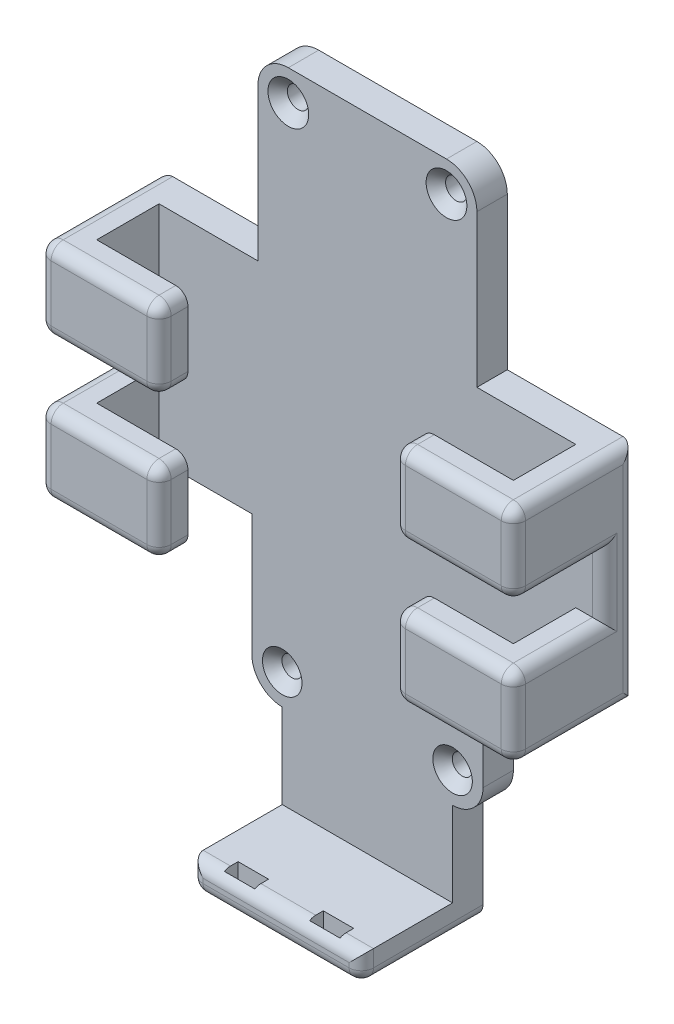
from build123d import *
from build123d.topology import SkipClean

# Parameters (mm, degrees)
SKETCH1_R           = 1.6500000000000001
SKETCH1_R_2         = 1.6499999999999986
SKETCH1_R_3         = 1.7500000000000004
BOSS_EXTRUDE1_DEPTH = 5
CHAMFER1_SIZE       = 1.6
SKETCH4_W           = 28
SKETCH4_H           = 4.75
BOSS_EXTRUDE2_DEPTH = 15
BOSS_EXTRUDE3_DEPTH = 15
CUT_EXTRUDE1_DEPTH  = 10
SKETCH9_W           = 4.749999999999998
SKETCH9_H           = 13.250000000000005
BOSS_EXTRUDE4_DEPTH = 15
SKETCH10_W          = 5.000000000000001
SKETCH10_H          = 2.2500000000000036
CUT_EXTRUDE2_DEPTH  = 15
SKETCH11_W          = 15
SKETCH11_H          = 10.000000000000002
CUT_EXTRUDE3_DEPTH  = 15
FILLET1_R           = 2
CHAMFER2_SIZE       = 1.6


with BuildPart() as part:
    # Sketch1 → Boss-Extrude1 (new body)
    with BuildSketch(Plane.XY):
        with BuildLine():
            Line((-18.000000000000004, 57.02680671662054), (-18.00000000000001, -24.473193283379477))
            ThreePointArc((-18.00000000000001, -24.473193283379477), (-16.872983346207427, -27.635470943547862), (-14.000000000000002, -29.372172768945834))
            Line((-14.000000000000002, -29.372172768945834), (-13.999999999999998, -48.122172768945845))
            Line((-13.999999999999998, -48.122172768945845), (14.000000000000004, -48.122172768945845))
            Line((14.000000000000004, -48.122172768945845), (14.000000000000004, -29.473193283379494))
            ThreePointArc((14.000000000000004, -29.473193283379494), (17.535533905932745, -28.008727189312218), (19.000000000000007, -24.47319328337948))
            Line((19.000000000000007, -24.47319328337948), (19.00000000000001, -4.47319328337948))
            Line((19.00000000000001, -4.47319328337948), (39.00000000000001, -4.4731932833794765))
            Line((39.00000000000001, -4.4731932833794765), (39, 32.026806716620534))
            Line((39, 32.026806716620534), (18.000000000000004, 32.026806716620534))
            Line((18.000000000000004, 32.026806716620534), (17.99999999999999, 52.02680671662054))
            Line((17.99999999999999, 52.02680671662054), (18.000000000000004, 57.02680671662054))
            ThreePointArc((18.000000000000004, 57.02680671662054), (16.535533905932727, 60.562340622553265), (13, 62.02680671662053))
            Line((13, 62.02680671662053), (-13, 62.02680671662053))
            ThreePointArc((-13, 62.02680671662053), (-16.535533905932738, 60.56234062255327), (-18.000000000000004, 57.02680671662054))
        make_face()
        with Locations((-14.000000000000002, -24.473193283379477)):
            Circle(SKETCH1_R, mode=Mode.SUBTRACT)
        with Locations((14.000000000000002, -24.473193283379477)):
            Circle(SKETCH1_R_2, mode=Mode.SUBTRACT)
        with Locations((-13.000000000000009, 57.02680671662053)):
            Circle(SKETCH1_R_3, mode=Mode.SUBTRACT)
        with Locations(Location((13, 57.02680671662054, 0), (0, 0, 180))):
            Circle(SKETCH1_R_3, mode=Mode.SUBTRACT)
    boss_extrude1 = extrude(amount=BOSS_EXTRUDE1_DEPTH)

    # Chamfer1
    chamfer1_edges = [part.edges().sort_by_distance(p)[0] for p in [
        (-14.750000000000009, 57.02680671662053, 0),
        (14.75, 57.02680671662054, 0),
        (-15.650000000000002, -24.473193283379477, 0),
        (12.350000000000003, -24.473193283379477, 0),
    ]]
    chamfer(chamfer1_edges, length=CHAMFER1_SIZE)

    # Sketch4 → Boss-Extrude2 (add)
    with BuildSketch(Plane.XY.offset(5)):
        with Locations((2.66e-15, -45.747172768945845)):
            Rectangle(SKETCH4_W, SKETCH4_H)
    extrude(amount=BOSS_EXTRUDE2_DEPTH)

    # Sketch7 → Boss-Extrude3 (add)
    with BuildSketch(Plane.XY.offset(5)):
        Polygon((39.00000000000001, 32.026806716620534), (39.000000000000014, -4.47319328337948), (34.250000000000014, -4.47319328337948), (34.25000000000001, 32.026806716620534), align=None)
    boss_extrude3 = extrude(amount=BOSS_EXTRUDE3_DEPTH)

    # Sketch8 → Cut-Extrude1 (cut)
    with BuildSketch(Plane.ZY.offset(-34.250000000000014)):
        Polygon((20, 8.776806716620532), (5, 8.77680671662053), (5, 18.776806716620534), (20, 18.776806716620534), align=None)
    extrude(amount=-CUT_EXTRUDE1_DEPTH, mode=Mode.SUBTRACT)

    # Sketch9 → Boss-Extrude4 (add)
    with BuildSketch(Plane.ZY.offset(-34.250000000000014)):
        Polygon((20, 32.026806716620534), (15.25, 32.026806716620534), (15.250000000000002, 18.776806716620534), (20.000000000000004, 18.776806716620534), align=None)
        with Locations((17.625, 2.1518067166205297)):
            Rectangle(SKETCH9_W, SKETCH9_H)
    boss_extrude4 = extrude(amount=BOSS_EXTRUDE4_DEPTH)

    # Mirror1: Boss-Extrude1, Boss-Extrude3, Boss-Extrude4 across plane
    with SkipClean():  # the faces are left unmerged after this step: merging them gives an invalid solid
        add(boss_extrude1.mirror(Plane(origin=(0, 0, 0), x_dir=(0, 0, 1), z_dir=(1, 9e-17, 0))))
        add(boss_extrude3.mirror(Plane(origin=(0, 0, 0), x_dir=(0, 0, 1), z_dir=(1, 9e-17, 0))))
        add(boss_extrude4.mirror(Plane(origin=(0, 0, 0), x_dir=(0, 0, 1), z_dir=(1, 9e-17, 0))))

    # Sketch10 → Cut-Extrude2 (cut)
    with SkipClean():  # the faces are left unmerged after this step: merging them gives an invalid solid
        with BuildSketch(Plane(origin=(0, -43.372172768945845, 0), x_dir=(1, 0, 0), z_dir=(0, 1, 0))):
            with Locations((-7.000000000000002, -17.875)):
                Rectangle(SKETCH10_W, SKETCH10_H)
            with Locations((7.000000000000002, -17.875)):
                Rectangle(SKETCH10_W, SKETCH10_H)
        extrude(amount=-CUT_EXTRUDE2_DEPTH, mode=Mode.SUBTRACT)

    # Sketch11 → Cut-Extrude3 (cut)
    with SkipClean():  # the faces are left unmerged after this step: merging them gives an invalid solid
        with BuildSketch(Plane(origin=(-34.250000000000014, 1.7e-16, 0), x_dir=(0, 0, -1), z_dir=(1, -1e-17, 0))):
            with Locations((-12.5, 13.776806716620541)):
                Rectangle(SKETCH11_W, SKETCH11_H)
        extrude(amount=-CUT_EXTRUDE3_DEPTH, mode=Mode.SUBTRACT)

    # Fillet1
    # the kernel refuses this fillet: 2 mm, written as the material it takes off along each edge
    with BuildSketch(Plane(origin=(37.00000000000001, 30.026806716620534, 18), x_dir=(0, 1, 0), z_dir=(0, 0, 1))) as fillet1_piece_1_section:
        Polygon((0, 0), (FILLET1_R, 0), (FILLET1_R, -FILLET1_R), (3.9e-16, -FILLET1_R), align=None)
    fillet1_piece_1 = extrude(amount=FILLET1_R, mode=Mode.PRIVATE)
    fillet1_piece_1 = fillet1_piece_1 - Plane(origin=(37.00000000000001, 30.026806716620534, 18), x_dir=(-0.7071067811865475, -0.7071067811865477, 0), z_dir=(0, 0, 1)) * Sphere(FILLET1_R, mode=Mode.PRIVATE)
    add(fillet1_piece_1, mode=Mode.SUBTRACT)
    with BuildSketch(Plane(origin=(37.00000000000001, 20.77680671662054, 18), x_dir=(9e-17, -1, 0), z_dir=(0, 0, 1))) as fillet1_piece_2_section:
        Polygon((0, 0), (FILLET1_R, 0), (FILLET1_R, FILLET1_R), (-2.1e-16, FILLET1_R), align=None)
    fillet1_piece_2 = extrude(amount=FILLET1_R, mode=Mode.PRIVATE)
    fillet1_piece_2 = fillet1_piece_2 - Plane(origin=(37.00000000000001, 20.77680671662054, 18), x_dir=(-0.7071067811865476, 0.7071067811865475, 0), z_dir=(0, 0, 1)) * Sphere(FILLET1_R, mode=Mode.PRIVATE)
    add(fillet1_piece_2, mode=Mode.SUBTRACT)
    with BuildSketch(Plane(origin=(21.250000000000014, 20.776806716620538, 18), x_dir=(-1, -9e-17, 0), z_dir=(0, 0, 1))) as fillet1_piece_3_section:
        Polygon((0, 0), (FILLET1_R, 0), (FILLET1_R, FILLET1_R), (0, FILLET1_R), align=None)
    fillet1_piece_3 = extrude(amount=FILLET1_R, mode=Mode.PRIVATE)
    fillet1_piece_3 = fillet1_piece_3 - Plane(origin=(21.250000000000014, 20.776806716620538, 18), x_dir=(0.7071067811865475, 0.7071067811865476, 0), z_dir=(0, 0, 1)) * Sphere(FILLET1_R, mode=Mode.PRIVATE)
    add(fillet1_piece_3, mode=Mode.SUBTRACT)
    with BuildSketch(Plane(origin=(21.250000000000014, 6.776806716620538, 18), x_dir=(0, 0, 1), z_dir=(-9e-17, 1, -1.2e-16))) as fillet1_piece_4_section:
        Polygon((0, 0), (FILLET1_R, 0), (FILLET1_R, -FILLET1_R), (0, -FILLET1_R), align=None)
    fillet1_piece_4 = extrude(amount=FILLET1_R, mode=Mode.PRIVATE)
    fillet1_piece_4 = fillet1_piece_4 - Plane(origin=(21.250000000000014, 6.776806716620538, 18), x_dir=(0.7071067811865475, 0, -0.7071067811865475), z_dir=(-9e-17, 1, -1.2e-16)) * Sphere(FILLET1_R, mode=Mode.PRIVATE)
    add(fillet1_piece_4, mode=Mode.SUBTRACT)
    with BuildSketch(Plane(origin=(37.000000000000014, 6.7768067166205395, 18), x_dir=(0, 0, 1), z_dir=(-9e-17, 1, -1.2e-16))) as fillet1_piece_5_section:
        Polygon((0, 0), (FILLET1_R, 0), (FILLET1_R, FILLET1_R), (0, FILLET1_R), align=None)
    fillet1_piece_5 = extrude(amount=FILLET1_R, mode=Mode.PRIVATE)
    fillet1_piece_5 = fillet1_piece_5 - Plane(origin=(37.000000000000014, 6.7768067166205395, 18), x_dir=(-0.7071067811865475, 0, -0.7071067811865475), z_dir=(-9e-17, 1, -1.2e-16)) * Sphere(FILLET1_R, mode=Mode.PRIVATE)
    add(fillet1_piece_5, mode=Mode.SUBTRACT)
    with BuildSketch(Plane(origin=(21.25000000000001, 30.02680671662054, 18), x_dir=(-1, -9e-17, 0), z_dir=(0, 0, 1))) as fillet1_piece_6_section:
        Polygon((0, 0), (FILLET1_R, 0), (FILLET1_R, -FILLET1_R), (-1.8e-16, -FILLET1_R), align=None)
    fillet1_piece_6 = extrude(amount=FILLET1_R, mode=Mode.PRIVATE)
    fillet1_piece_6 = fillet1_piece_6 - Plane(origin=(21.25000000000001, 30.02680671662054, 18), x_dir=(0.7071067811865476, -0.7071067811865475, 0), z_dir=(0, 0, 1)) * Sphere(FILLET1_R, mode=Mode.PRIVATE)
    add(fillet1_piece_6, mode=Mode.SUBTRACT)
    with BuildSketch(Plane(origin=(21.250000000000014, -2.47319328337948, 18), x_dir=(0, 0, 1), z_dir=(1.8e-16, -1, 0))) as fillet1_piece_7_section:
        Polygon((0, 0), (FILLET1_R, 0), (FILLET1_R, FILLET1_R), (0, FILLET1_R), align=None)
    fillet1_piece_7 = extrude(amount=FILLET1_R, mode=Mode.PRIVATE)
    fillet1_piece_7 = fillet1_piece_7 - Plane(origin=(21.250000000000014, -2.47319328337948, 18), x_dir=(0.7071067811865475, 0, -0.7071067811865475), z_dir=(1.8e-16, -1, 0)) * Sphere(FILLET1_R, mode=Mode.PRIVATE)
    add(fillet1_piece_7, mode=Mode.SUBTRACT)
    with BuildSketch(Plane(origin=(-37.000000000000014, 30.026806716620527, 18), x_dir=(-1.9e-16, 1, 0), z_dir=(-1, 1e-17, 0))) as fillet1_piece_8_section:
        Polygon((0, 0), (FILLET1_R, 0), (FILLET1_R, -FILLET1_R), (0, -FILLET1_R), align=None)
    fillet1_piece_8 = extrude(amount=FILLET1_R, mode=Mode.PRIVATE)
    fillet1_piece_8 = fillet1_piece_8 - Plane(origin=(-37.000000000000014, 30.026806716620527, 18), x_dir=(0, -0.7071067811865475, -0.7071067811865475), z_dir=(-1, 1e-17, 0)) * Sphere(FILLET1_R, mode=Mode.PRIVATE)
    add(fillet1_piece_8, mode=Mode.SUBTRACT)
    with BuildSketch(Plane(origin=(-37.000000000000014, -2.473193283379487, 18), x_dir=(1.9e-16, -1, 0), z_dir=(-1, 1e-17, 0))) as fillet1_piece_9_section:
        Polygon((0, 0), (FILLET1_R, 0), (FILLET1_R, FILLET1_R), (0, FILLET1_R), align=None)
    fillet1_piece_9 = extrude(amount=FILLET1_R, mode=Mode.PRIVATE)
    fillet1_piece_9 = fillet1_piece_9 - Plane(origin=(-37.000000000000014, -2.473193283379487, 18), x_dir=(0, 0.7071067811865475, -0.7071067811865475), z_dir=(-1, 1e-17, 0)) * Sphere(FILLET1_R, mode=Mode.PRIVATE)
    add(fillet1_piece_9, mode=Mode.SUBTRACT)
    with BuildSketch(Plane(origin=(-21.250000000000014, -2.473193283379471, 18), x_dir=(9e-17, -1, 0), z_dir=(0, 0, 1))) as fillet1_piece_10_section:
        Polygon((0, 0), (FILLET1_R, 0), (FILLET1_R, FILLET1_R), (0, FILLET1_R), align=None)
    fillet1_piece_10 = extrude(amount=FILLET1_R, mode=Mode.PRIVATE)
    fillet1_piece_10 = fillet1_piece_10 - Plane(origin=(-21.250000000000014, -2.473193283379471, 18), x_dir=(-0.7071067811865476, 0.7071067811865475, 0), z_dir=(0, 0, 1)) * Sphere(FILLET1_R, mode=Mode.PRIVATE)
    add(fillet1_piece_10, mode=Mode.SUBTRACT)
    with BuildSketch(Plane(origin=(-21.25000000000002, 30.026806716620534, 18), x_dir=(-9e-17, 1, 0), z_dir=(0, 2.7e-16, 1))) as fillet1_piece_11_section:
        Polygon((0, 0), (FILLET1_R, 0), (FILLET1_R, -FILLET1_R), (0, -FILLET1_R), align=None)
    fillet1_piece_11 = extrude(amount=FILLET1_R, mode=Mode.PRIVATE)
    fillet1_piece_11 = fillet1_piece_11 - Plane(origin=(-21.25000000000002, 30.026806716620534, 18), x_dir=(-0.7071067811865475, -0.7071067811865476, 0), z_dir=(0, 2.7e-16, 1)) * Sphere(FILLET1_R, mode=Mode.PRIVATE)
    add(fillet1_piece_11, mode=Mode.SUBTRACT)
    with BuildSketch(Plane(origin=(-37.000000000000014, 6.776806716620541, 18), x_dir=(1e-17, 1, 0), z_dir=(-1, 1e-17, 0))) as fillet1_piece_12_section:
        Polygon((0, 0), (FILLET1_R, 0), (FILLET1_R, -FILLET1_R), (0, -FILLET1_R), align=None)
    fillet1_piece_12 = extrude(amount=FILLET1_R, mode=Mode.PRIVATE)
    fillet1_piece_12 = fillet1_piece_12 - Plane(origin=(-37.000000000000014, 6.776806716620541, 18), x_dir=(0, -0.7071067811865475, -0.7071067811865475), z_dir=(-1, 1e-17, 0)) * Sphere(FILLET1_R, mode=Mode.PRIVATE)
    add(fillet1_piece_12, mode=Mode.SUBTRACT)
    with BuildSketch(Plane(origin=(-21.25000000000001, 20.776806716620534, 18.000000000000004), x_dir=(9e-17, -1, 0), z_dir=(0, 2.7e-16, 1))) as fillet1_piece_13_section:
        Polygon((0, 0), (FILLET1_R, 0), (FILLET1_R, FILLET1_R), (0, FILLET1_R), align=None)
    fillet1_piece_13 = extrude(amount=FILLET1_R, mode=Mode.PRIVATE)
    fillet1_piece_13 = fillet1_piece_13 - Plane(origin=(-21.25000000000001, 20.776806716620534, 18.000000000000004), x_dir=(-0.7071067811865476, 0.7071067811865475, 0), z_dir=(0, 2.7e-16, 1)) * Sphere(FILLET1_R, mode=Mode.PRIVATE)
    add(fillet1_piece_13, mode=Mode.SUBTRACT)
    with BuildSketch(Plane(origin=(-21.250000000000014, 6.776806716620534, 18), x_dir=(1, 9e-17, 0), z_dir=(0, 0, 1))) as fillet1_piece_14_section:
        Polygon((0, 0), (FILLET1_R, 0), (FILLET1_R, FILLET1_R), (0, FILLET1_R), align=None)
    fillet1_piece_14 = extrude(amount=FILLET1_R, mode=Mode.PRIVATE)
    fillet1_piece_14 = fillet1_piece_14 - Plane(origin=(-21.250000000000014, 6.776806716620534, 18), x_dir=(-0.7071067811865475, -0.7071067811865476, 0), z_dir=(0, 0, 1)) * Sphere(FILLET1_R, mode=Mode.PRIVATE)
    add(fillet1_piece_14, mode=Mode.SUBTRACT)
    with BuildSketch(Plane(origin=(37.000000000000014, -2.4731932833794765, 18), x_dir=(0, 0, 1), z_dir=(1.8e-16, -1, 0))) as fillet1_piece_15_section:
        Polygon((0, 0), (FILLET1_R, 0), (FILLET1_R, -FILLET1_R), (0, -FILLET1_R), align=None)
    fillet1_piece_15 = extrude(amount=FILLET1_R, mode=Mode.PRIVATE)
    fillet1_piece_15 = fillet1_piece_15 - Plane(origin=(37.000000000000014, -2.4731932833794765, 18), x_dir=(-0.7071067811865475, 0, -0.7071067811865475), z_dir=(1.8e-16, -1, 0)) * Sphere(FILLET1_R, mode=Mode.PRIVATE)
    add(fillet1_piece_15, mode=Mode.SUBTRACT)
    with BuildSketch(Plane(origin=(12.000000000000002, -46.122172768945845, 18), x_dir=(1, 0, 0), z_dir=(0, -1, 0))) as fillet1_piece_16_section:
        Polygon((0, 0), (FILLET1_R, 0), (FILLET1_R, FILLET1_R), (0, FILLET1_R), align=None)
    fillet1_piece_16 = extrude(amount=FILLET1_R, mode=Mode.PRIVATE)
    fillet1_piece_16 = fillet1_piece_16 - Plane(origin=(12.000000000000002, -46.122172768945845, 18), x_dir=(-0.7071067811865475, 0, -0.7071067811865475), z_dir=(0, -1, 0)) * Sphere(FILLET1_R, mode=Mode.PRIVATE)
    add(fillet1_piece_16, mode=Mode.SUBTRACT)
    with BuildSketch(Plane(origin=(-11.999999999999998, -46.122172768945845, 18), x_dir=(0, -1, 0), z_dir=(-1, -1.9e-16, 0))) as fillet1_piece_17_section:
        Polygon((0, 0), (FILLET1_R, 0), (FILLET1_R, FILLET1_R), (0, FILLET1_R), align=None)
    fillet1_piece_17 = extrude(amount=FILLET1_R, mode=Mode.PRIVATE)
    fillet1_piece_17 = fillet1_piece_17 - Plane(origin=(-11.999999999999998, -46.122172768945845, 18), x_dir=(0, 0.7071067811865475, -0.7071067811865475), z_dir=(-1, -1.9e-16, 0)) * Sphere(FILLET1_R, mode=Mode.PRIVATE)
    add(fillet1_piece_17, mode=Mode.SUBTRACT)
    with BuildSketch(Plane(origin=(-37.000000000000014, 20.77680671662054, 18), x_dir=(-1, 1e-17, 0), z_dir=(-1e-17, -1, 0))) as fillet1_piece_18_section:
        Polygon((0, 0), (FILLET1_R, 0), (FILLET1_R, -FILLET1_R), (0, -FILLET1_R), align=None)
    fillet1_piece_18 = extrude(amount=FILLET1_R, mode=Mode.PRIVATE)
    fillet1_piece_18 = fillet1_piece_18 - Plane(origin=(-37.000000000000014, 20.77680671662054, 18), x_dir=(0.7071067811865475, 0, -0.7071067811865475), z_dir=(-1e-17, -1, 0)) * Sphere(FILLET1_R, mode=Mode.PRIVATE)
    add(fillet1_piece_18, mode=Mode.SUBTRACT)
    with BuildSketch(Plane(origin=(39.00000000000001, 30.026806716620527, 20), x_dir=(-3.55e-15, 0, -1), z_dir=(1.9e-16, -1, 0))) as fillet1_piece_19:
        with BuildLine():
            CenterArc((FILLET1_R, -FILLET1_R), FILLET1_R, 90.0000000000002, 89.9999999999998)
            Line((7.11e-15, -FILLET1_R), (0, 0))
            Line((0, 0), (FILLET1_R, 0))
        make_face()
    extrude(amount=9.249999999999986, mode=Mode.SUBTRACT)
    with BuildSketch(Plane(origin=(37.00000000000001, 18.77680671662054, 20), x_dir=(-1.8e-16, 0, -1), z_dir=(-1, -1.8e-16, 1.8e-16))) as fillet1_piece_20:
        with BuildLine():
            CenterArc((FILLET1_R, -FILLET1_R), FILLET1_R, 90, 90)
            Line((0, -FILLET1_R), (0, 0))
            Line((0, 0), (FILLET1_R, 0))
        make_face()
    extrude(amount=15.749999999999993, mode=Mode.SUBTRACT)
    with BuildSketch(Plane(origin=(21.250000000000014, 8.776806716620538, 20), x_dir=(0, 0, -1), z_dir=(1, 1.8e-16, 0))) as fillet1_piece_21:
        with BuildLine():
            CenterArc((FILLET1_R, -FILLET1_R), FILLET1_R, 90, 90)
            Line((0, -FILLET1_R), (0, 0))
            Line((0, 0), (FILLET1_R, 0))
        make_face()
    extrude(amount=15.75, mode=Mode.SUBTRACT)
    with BuildSketch(Plane(origin=(39.00000000000001, 8.776806716620538, 5), x_dir=(-1, -1.9e-16, 0), z_dir=(-1.9e-16, 1, 0))) as fillet1_piece_22:
        with BuildLine():
            CenterArc((FILLET1_R, -FILLET1_R), FILLET1_R, 90, 90)
            Line((0, -FILLET1_R), (0, 0))
            Line((0, 0), (FILLET1_R, 0))
        make_face()
    extrude(amount=10.000000000000004, mode=Mode.SUBTRACT)
    with BuildSketch(Plane(origin=(39.00000000000001, 8.77680671662054, 18), x_dir=(0, -1, 1.2e-16), z_dir=(0, -1.2e-16, -1))) as fillet1_piece_23:
        with BuildLine():
            CenterArc((FILLET1_R, FILLET1_R), FILLET1_R, 180, 90)
            Line((0, FILLET1_R), (0, 0))
            Line((0, 0), (FILLET1_R, 0))
        make_face()
    extrude(amount=13, mode=Mode.SUBTRACT)
    with BuildSketch(Plane(origin=(39, 18.77680671662054, 5), x_dir=(-1, 0, 0), z_dir=(0, 0, 1)), Plane(origin=(-39.000000000000014, 32.02680671662053, 5), x_dir=(1, 0, 0), z_dir=(0, 0, 1)), Plane(origin=(-39.000000000000014, 18.77680671662054, 18), x_dir=(1, 0, 0), z_dir=(0, 0, -1))) as fillet1_piece_24:
        with BuildLine():
            CenterArc((FILLET1_R, -FILLET1_R), FILLET1_R, 90, 90)
            Line((0, -FILLET1_R), (0, 0))
            Line((0, 0), (FILLET1_R, 0))
        make_face()
    extrude(amount=13, mode=Mode.SUBTRACT)
    with BuildSketch(Plane(origin=(19.25000000000001, 20.776806716620538, 20.000000000000004), x_dir=(1, 9e-17, -1.78e-15), z_dir=(-9e-17, 1, -2.7e-16))) as fillet1_piece_25:
        with BuildLine():
            CenterArc((FILLET1_R, FILLET1_R), FILLET1_R, 180, 89.99999999999989)
            Line((3.55e-15, FILLET1_R), (0, 0))
            Line((0, 0), (FILLET1_R, 0))
        make_face()
    extrude(amount=9.25, mode=Mode.SUBTRACT)
    with BuildSketch(Plane(origin=(19.25000000000001, 32.02680671662054, 18), x_dir=(1, -3.55e-15, 0), z_dir=(0, 0, -1))) as fillet1_piece_26:
        with BuildLine():
            CenterArc((FILLET1_R, FILLET1_R), FILLET1_R, 180, 89.99999999999977)
            Line((7.11e-15, FILLET1_R), (0, 0))
            Line((0, 0), (FILLET1_R, 0))
        make_face()
    extrude(amount=7.749999999999998, mode=Mode.SUBTRACT)
    with BuildSketch(Plane(origin=(19.25000000000001, 18.77680671662054, 10.250000000000004), x_dir=(1, 0, 0), z_dir=(0, 0, 1))) as fillet1_piece_27:
        with BuildLine():
            CenterArc((FILLET1_R, FILLET1_R), FILLET1_R, 180, 90)
            Line((0, FILLET1_R), (0, 0))
            Line((0, 0), (FILLET1_R, 0))
        make_face()
    extrude(amount=7.7499999999999964, mode=Mode.SUBTRACT)
    with BuildSketch(Plane(origin=(19.250000000000014, -2.47319328337948, 20), x_dir=(1, 9e-17, 0), z_dir=(-9e-17, 1, 0))) as fillet1_piece_28:
        with BuildLine():
            CenterArc((FILLET1_R, FILLET1_R), FILLET1_R, 180, 90)
            Line((0, FILLET1_R), (0, 0))
            Line((0, 0), (FILLET1_R, 0))
        make_face()
    extrude(amount=9.250000000000018, mode=Mode.SUBTRACT)
    with BuildSketch(Plane(origin=(19.250000000000014, 8.776806716620538, 18), x_dir=(1, 0, 0), z_dir=(0, 0, -1))) as fillet1_piece_29:
        with BuildLine():
            CenterArc((FILLET1_R, FILLET1_R), FILLET1_R, 180, 90)
            Line((0, FILLET1_R), (0, 0))
            Line((0, 0), (FILLET1_R, 0))
        make_face()
    extrude(amount=7.749999999999998, mode=Mode.SUBTRACT)
    with BuildSketch(Plane(origin=(19.250000000000014, -4.47319328337948, 10.25), x_dir=(1, 0, 0), z_dir=(0, 0, 1))) as fillet1_piece_30:
        with BuildLine():
            CenterArc((FILLET1_R, FILLET1_R), FILLET1_R, 180, 90)
            Line((0, FILLET1_R), (0, 0))
            Line((0, 0), (FILLET1_R, 0))
        make_face()
    extrude(amount=7.75, mode=Mode.SUBTRACT)
    with BuildSketch(Plane(origin=(-39.000000000000014, -4.473193283379487, 5), x_dir=(1, 0, 0), z_dir=(0, 0, 1))) as fillet1_piece_31:
        with BuildLine():
            CenterArc((FILLET1_R, FILLET1_R), FILLET1_R, 180, 90)
            Line((0, FILLET1_R), (0, 0))
            Line((0, 0), (FILLET1_R, 0))
        make_face()
    extrude(amount=13, mode=Mode.SUBTRACT)
    with BuildSketch(Plane(origin=(39.00000000000001, -9.473193283379477, 0), x_dir=(0, 0, 1), z_dir=(-1.9e-16, 1, 0))) as fillet1_piece_32:
        with BuildLine():
            CenterArc((FILLET1_R, -FILLET1_R), FILLET1_R, 90, 90)
            Line((-2.2e-16, -FILLET1_R), (0, 0))
            Line((0, 0), (FILLET1_R, 0))
        make_face()
    extrude(amount=46.500000000000014, mode=Mode.SUBTRACT)
    with BuildSketch(Plane(origin=(-39.00000000000001, -9.473193283379484, 0), x_dir=(1, -1e-17, 0), z_dir=(1e-17, 1, 0))) as fillet1_piece_33:
        with BuildLine():
            CenterArc((FILLET1_R, -FILLET1_R), FILLET1_R, 90, 90)
            Line((7.11e-15, -FILLET1_R), (0, 0))
            Line((0, 0), (FILLET1_R, 0))
        make_face()
    extrude(amount=46.500000000000014, mode=Mode.SUBTRACT)
    with BuildSketch(Plane(origin=(-34.250000000000014, -4.473193283379473, 20), x_dir=(0, 0, -1), z_dir=(1, 9e-17, 0))) as fillet1_piece_34:
        with BuildLine():
            CenterArc((FILLET1_R, FILLET1_R), FILLET1_R, 180, 90)
            Line((0, FILLET1_R), (0, 0))
            Line((0, 0), (FILLET1_R, 0))
        make_face()
    extrude(amount=13, mode=Mode.SUBTRACT)
    with BuildSketch(Plane(origin=(-34.25000000000002, 32.026806716620534, 20), x_dir=(0, 0, -1), z_dir=(1, 9e-17, 0))) as fillet1_piece_35:
        with BuildLine():
            CenterArc((FILLET1_R, -FILLET1_R), FILLET1_R, 90, 90)
            Line((0, -FILLET1_R), (0, 0))
            Line((0, 0), (FILLET1_R, 0))
        make_face()
    extrude(amount=12.999999999999996, mode=Mode.SUBTRACT)
    with BuildSketch(Plane(origin=(-39.000000000000014, 6.776806716620541, 20), x_dir=(1, -1e-17, 0), z_dir=(-1e-17, -1, 0))) as fillet1_piece_36:
        with BuildLine():
            CenterArc((FILLET1_R, -FILLET1_R), FILLET1_R, 90, 90)
            Line((0, -FILLET1_R), (0, 0))
            Line((0, 0), (FILLET1_R, 0))
        make_face()
    extrude(amount=9.250000000000028, mode=Mode.SUBTRACT)
    with BuildSketch(Plane(origin=(-19.250000000000014, 20.776806716620534, 20.000000000000004), x_dir=(0, -2.7e-16, -1), z_dir=(-9e-17, 1, -2.7e-16))) as fillet1_piece_37:
        with BuildLine():
            CenterArc((FILLET1_R, FILLET1_R), FILLET1_R, 180.0000000000001, 89.99999999999989)
            Line((0, FILLET1_R), (0, 0))
            Line((0, 0), (FILLET1_R, 0))
        make_face()
    extrude(amount=9.249999999999993, mode=Mode.SUBTRACT)
    with BuildSketch(Plane(origin=(-19.250000000000014, 18.776806716620534, 10.250000000000004), x_dir=(-1, 0, 0), z_dir=(0, 0, 1)), Plane(origin=(-14, -38.372172768945845, 20), x_dir=(1, 0, 0), z_dir=(0, -1, 0))) as fillet1_piece_38:
        with BuildLine():
            CenterArc((FILLET1_R, -FILLET1_R), FILLET1_R, 90, 90)
            Line((0, -FILLET1_R), (0, 0))
            Line((0, 0), (FILLET1_R, 0))
        make_face()
    extrude(amount=7.75, mode=Mode.SUBTRACT)
    with BuildSketch(Plane(origin=(-34.250000000000014, 18.776806716620534, 20.000000000000004), x_dir=(0, 0, -1), z_dir=(1, 9e-17, 0))) as fillet1_piece_39:
        with BuildLine():
            CenterArc((FILLET1_R, FILLET1_R), FILLET1_R, 180, 90)
            Line((0, FILLET1_R), (0, 0))
            Line((0, 0), (FILLET1_R, 0))
        make_face()
    extrude(amount=13.000000000000004, mode=Mode.SUBTRACT)
    with BuildSketch(Plane(origin=(-19.250000000000014, 32.02680671662054, 18), x_dir=(-1, -3.55e-15, 0), z_dir=(0, 0, -1))) as fillet1_piece_40:
        with BuildLine():
            CenterArc((FILLET1_R, -FILLET1_R), FILLET1_R, 90.0000000000002, 89.9999999999998)
            Line((3.55e-15, -FILLET1_R), (0, 0))
            Line((0, 0), (FILLET1_R, 0))
        make_face()
    extrude(amount=7.749999999999998, mode=Mode.SUBTRACT)
    with BuildSketch(Plane(origin=(-19.250000000000014, -2.473193283379471, 20), x_dir=(0, 0, -1), z_dir=(-9e-17, 1, 0))) as fillet1_piece_41:
        with BuildLine():
            CenterArc((FILLET1_R, FILLET1_R), FILLET1_R, 180, 90)
            Line((0, FILLET1_R), (0, 0))
            Line((0, 0), (FILLET1_R, 0))
        make_face()
    extrude(amount=9.250000000000005, mode=Mode.SUBTRACT)
    with BuildSketch(Plane(origin=(-34.250000000000014, 8.776806716620532, 20), x_dir=(0, 0, -1), z_dir=(1, 9e-17, 0))) as fillet1_piece_42:
        with BuildLine():
            CenterArc((FILLET1_R, -FILLET1_R), FILLET1_R, 90, 90)
            Line((0, -FILLET1_R), (0, 0))
            Line((0, 0), (FILLET1_R, 0))
        make_face()
    extrude(amount=13, mode=Mode.SUBTRACT)
    with BuildSketch(Plane(origin=(-19.250000000000014, -4.473193283379471, 10.250000000000002), x_dir=(-1, -4.4e-16, 0), z_dir=(0, 0, 1))) as fillet1_piece_43:
        with BuildLine():
            CenterArc((FILLET1_R, -FILLET1_R), FILLET1_R, 89.99999999999997, 90.00000000000003)
            Line((-8.9e-16, -FILLET1_R), (0, 0))
            Line((0, 0), (FILLET1_R, 0))
        make_face()
    extrude(amount=7.749999999999998, mode=Mode.SUBTRACT)
    with BuildSketch(Plane(origin=(-19.250000000000014, 8.776806716620534, 18), x_dir=(-1, 0, 0), z_dir=(0, 0, -1))) as fillet1_piece_44:
        with BuildLine():
            CenterArc((FILLET1_R, -FILLET1_R), FILLET1_R, 90, 90)
            Line((0, -FILLET1_R), (0, 0))
            Line((0, 0), (FILLET1_R, 0))
        make_face()
    extrude(amount=7.749999999999998, mode=Mode.SUBTRACT)
    with BuildSketch(Plane(origin=(39.00000000000001, 32.026806716620534, 18), x_dir=(-1, 0, 3.6e-16), z_dir=(-3.6e-16, 0, -1))) as fillet1_piece_45:
        with BuildLine():
            CenterArc((FILLET1_R, -FILLET1_R), FILLET1_R, 90, 89.99999999999989)
            Line((0, -FILLET1_R), (0, 0))
            Line((0, 0), (FILLET1_R, 0))
        make_face()
    extrude(amount=23, mode=Mode.SUBTRACT)
    with BuildSketch(Plane(origin=(39.00000000000001, -4.4731932833794765, -5.000000000000001), x_dir=(0, 1, 1.8e-16), z_dir=(3.6e-16, -1.8e-16, 1))) as fillet1_piece_46:
        with BuildLine():
            CenterArc((FILLET1_R, FILLET1_R), FILLET1_R, 180, 90)
            Line((0, FILLET1_R), (0, 0))
            Line((0, 0), (FILLET1_R, 0))
        make_face()
    extrude(amount=23, mode=Mode.SUBTRACT)
    with BuildSketch(Plane(origin=(14.000000000000004, -48.122172768945845, 18), x_dir=(0, 1, 0), z_dir=(0, 0, -1))) as fillet1_piece_47:
        with BuildLine():
            CenterArc((FILLET1_R, -FILLET1_R), FILLET1_R, 90, 90.00000000000006)
            Line((0, -FILLET1_R), (0, 0))
            Line((0, 0), (FILLET1_R, 0))
        make_face()
    extrude(amount=13, mode=Mode.SUBTRACT)
    with BuildSketch(Plane(origin=(-13.999999999999998, -48.122172768945845, 5), x_dir=(0, 1, 0), z_dir=(0, 0, 1))) as fillet1_piece_48:
        with BuildLine():
            CenterArc((FILLET1_R, -FILLET1_R), FILLET1_R, 90, 90)
            Line((0, -FILLET1_R), (0, 0))
            Line((0, 0), (FILLET1_R, 0))
        make_face()
    extrude(amount=13, mode=Mode.SUBTRACT)
    with BuildSketch(Plane(origin=(-39.000000000000014, 30.026806716620527, 20), x_dir=(0, 0, -1), z_dir=(-1e-17, -1, 0))) as fillet1_piece_49:
        with BuildLine():
            CenterArc((FILLET1_R, FILLET1_R), FILLET1_R, 179.9999999999998, 90.00000000000023)
            Line((0, FILLET1_R), (0, 0))
            Line((0, 0), (FILLET1_R, 0))
        make_face()
    extrude(amount=9.249999999999986, mode=Mode.SUBTRACT)
    with BuildSketch(Plane(origin=(-39.00000000000001, 8.77680671662054, 5), x_dir=(1, -1e-17, 0), z_dir=(1e-17, 1, 0))) as fillet1_piece_50:
        with BuildLine():
            CenterArc((FILLET1_R, FILLET1_R), FILLET1_R, 180, 90)
            Line((0, FILLET1_R), (0, 0))
            Line((0, 0), (FILLET1_R, 0))
        make_face()
    extrude(amount=10.000000000000002, mode=Mode.SUBTRACT)
    with BuildSketch(Plane(origin=(-39.000000000000014, 8.776806716620541, 5), x_dir=(1, -8.9e-16, 0), z_dir=(0, 0, 1))) as fillet1_piece_51:
        with BuildLine():
            CenterArc((FILLET1_R, -FILLET1_R), FILLET1_R, 90.00000000000006, 89.99999999999994)
            Line((1.78e-15, -FILLET1_R), (0, 0))
            Line((0, 0), (FILLET1_R, 0))
        make_face()
    extrude(amount=13, mode=Mode.SUBTRACT)
    with BuildSketch(Plane(origin=(-11.999999999999998, -48.122172768945845, 20), x_dir=(0, 1, 0), z_dir=(1, 0, 0))) as fillet1_piece_52:
        with BuildLine():
            CenterArc((FILLET1_R, -FILLET1_R), FILLET1_R, 90, 90)
            Line((0, -FILLET1_R), (0, 0))
            Line((0, 0), (FILLET1_R, 0))
        make_face()
    extrude(amount=24, mode=Mode.SUBTRACT)
    with BuildSketch(Plane(origin=(14.000000000000004, -46.122172768945845, 20), x_dir=(0, 0, -1), z_dir=(0, 1, 0))) as fillet1_piece_53:
        with BuildLine():
            CenterArc((FILLET1_R, FILLET1_R), FILLET1_R, 180, 90)
            Line((0, FILLET1_R), (0, 0))
            Line((0, 0), (FILLET1_R, 0))
        make_face()
    extrude(amount=7.75, mode=Mode.SUBTRACT)
    with BuildSketch(Plane(origin=(19.000000000000007, -43.372172768945845, 20), x_dir=(0, 0, -1), z_dir=(-1, 0, 0))) as fillet1_piece_54:
        with BuildLine():
            CenterArc((FILLET1_R, FILLET1_R), FILLET1_R, 180, 90)
            Line((0, FILLET1_R), (0, 0))
            Line((0, 0), (FILLET1_R, 0))
        make_face()
    extrude(amount=38, mode=Mode.SUBTRACT)
    with BuildSketch(Plane(origin=(37.000000000000014, -4.473193283379479, 20), x_dir=(0, 1.33e-15, -1), z_dir=(-1, 6.3e-16, 0))) as fillet1_piece_55:
        with BuildLine():
            CenterArc((FILLET1_R, -FILLET1_R), FILLET1_R, 90.00000000000007, 89.99999999999994)
            Line((2.66e-15, -FILLET1_R), (0, 0))
            Line((0, 0), (FILLET1_R, 0))
        make_face()
    extrude(amount=15.75, mode=Mode.SUBTRACT)
    with BuildSketch(Plane(origin=(39.000000000000014, 6.776806716620541, 20), x_dir=(-3.55e-15, 0, -1), z_dir=(1.9e-16, -1, 0))) as fillet1_piece_56:
        with BuildLine():
            CenterArc((FILLET1_R, -FILLET1_R), FILLET1_R, 90.0000000000002, 89.9999999999998)
            Line((7.11e-15, -FILLET1_R), (0, 0))
            Line((0, 0), (FILLET1_R, 0))
        make_face()
    extrude(amount=9.250000000000021, mode=Mode.SUBTRACT)
    with BuildSketch(Plane(origin=(21.25000000000001, 32.02680671662054, 20), x_dir=(0, -3.55e-15, -1), z_dir=(1, -3.6e-16, 0))) as fillet1_piece_57:
        with BuildLine():
            CenterArc((FILLET1_R, -FILLET1_R), FILLET1_R, 90.0000000000002, 89.9999999999998)
            Line((7.11e-15, -FILLET1_R), (0, 0))
            Line((0, 0), (FILLET1_R, 0))
        make_face()
    extrude(amount=15.749999999999996, mode=Mode.SUBTRACT)
    with BuildSketch(Plane(origin=(-13.999999999999998, -48.122172768945845, -5), x_dir=(0, 1, 0), z_dir=(0, 0, 1))) as fillet1_piece_58:
        with BuildLine():
            CenterArc((FILLET1_R, -FILLET1_R), FILLET1_R, 90, 90)
            Line((0, -FILLET1_R), (0, 0))
            Line((0, 0), (FILLET1_R, 0))
        make_face()
    extrude(amount=10, mode=Mode.SUBTRACT)
    with BuildSketch(Plane(origin=(14.000000000000004, -48.122172768945845, 5), x_dir=(0, 1, 0), z_dir=(0, 0, -1))) as fillet1_piece_59:
        with BuildLine():
            CenterArc((FILLET1_R, -FILLET1_R), FILLET1_R, 90, 90.00000000000006)
            Line((0, -FILLET1_R), (0, 0))
            Line((0, 0), (FILLET1_R, 0))
        make_face()
    extrude(amount=10.000000000000004, mode=Mode.SUBTRACT)
    with BuildSketch(Plane(origin=(-34.250000000000014, 8.77680671662054, 20), x_dir=(0, 0, -1), z_dir=(-1, 1e-17, 0))) as fillet1_piece_60:
        with BuildLine():
            CenterArc((FILLET1_R, FILLET1_R), FILLET1_R, 179.99999999999997, 90)
            Line((0, FILLET1_R), (0, 0))
            Line((0, 0), (FILLET1_R, 0))
        make_face()
    extrude(amount=2.75, mode=Mode.SUBTRACT)
    with BuildSketch(Plane(origin=(-34.250000000000014, 18.77680671662054, 20), x_dir=(0, 0, -1), z_dir=(-1, 1e-17, 0))) as fillet1_piece_61:
        with BuildLine():
            CenterArc((FILLET1_R, -FILLET1_R), FILLET1_R, 90, 90)
            Line((0, -FILLET1_R), (0, 0))
            Line((0, 0), (FILLET1_R, 0))
        make_face()
    extrude(amount=2.75, mode=Mode.SUBTRACT)
    with BuildSketch(Plane(origin=(-34.250000000000014, 32.02680671662053, 20), x_dir=(0, 0, -1), z_dir=(-1, -1.9e-16, 0))) as fillet1_piece_62:
        with BuildLine():
            CenterArc((FILLET1_R, FILLET1_R), FILLET1_R, 180, 90)
            Line((0, FILLET1_R), (0, 0))
            Line((0, 0), (FILLET1_R, 0))
        make_face()
    extrude(amount=2.75, mode=Mode.SUBTRACT)
    with BuildSketch(Plane(origin=(-37.000000000000014, -4.473193283379487, 20), x_dir=(0, 0, -1), z_dir=(1, 1.9e-16, 0))) as fillet1_piece_63:
        with BuildLine():
            CenterArc((FILLET1_R, FILLET1_R), FILLET1_R, 180.00000000000006, 89.99999999999994)
            Line((0, FILLET1_R), (0, 0))
            Line((0, 0), (FILLET1_R, 0))
        make_face()
    extrude(amount=2.75, mode=Mode.SUBTRACT)
    with BuildSketch(Plane(origin=(-39.00000000000001, -4.473193283379484, -5), x_dir=(1, 0, 0), z_dir=(0, 0, 1))) as fillet1_piece_64:
        with BuildLine():
            CenterArc((FILLET1_R, FILLET1_R), FILLET1_R, 180, 90)
            Line((0, FILLET1_R), (0, 0))
            Line((0, 0), (FILLET1_R, 0))
        make_face()
    extrude(amount=10, mode=Mode.SUBTRACT)
    with BuildSketch(Plane(origin=(-39.00000000000001, 32.02680671662053, -5), x_dir=(1, 0, 0), z_dir=(0, 0, 1))) as fillet1_piece_65:
        with BuildLine():
            CenterArc((FILLET1_R, -FILLET1_R), FILLET1_R, 90, 89.99999999999989)
            Line((0, -FILLET1_R), (0, 0))
            Line((0, 0), (FILLET1_R, 0))
        make_face()
    extrude(amount=10, mode=Mode.SUBTRACT)
    with BuildSketch(Plane(origin=(39.00000000000001, 3.776806716620536, 5), x_dir=(-1, -1.9e-16, 0), z_dir=(-1.9e-16, 1, 0))) as fillet1_piece_66a_section:
        with BuildLine():
            CenterArc((FILLET1_R, -FILLET1_R), FILLET1_R, 90, 90)
            Line((0, -FILLET1_R), (0, 0))
            Line((0, 0), (FILLET1_R, 0))
        make_face()
    fillet1_piece_66a = extrude(amount=15.000000000000005, mode=Mode.PRIVATE)
    fillet1_piece_66a = split(fillet1_piece_66a, bisect_by=Plane(origin=(38.547209771466356, 8.776806716620538, 4.547209771466351), z_dir=(9e-17, -1, 1.2e-16)), keep=Keep.TOP, mode=Mode.PRIVATE)
    with BuildSketch(Plane(origin=(39.00000000000001, 8.77680671662054, 18), x_dir=(0, -1, 1.2e-16), z_dir=(0, -1.2e-16, -1))) as fillet1_piece_66b_section:
        with BuildLine():
            CenterArc((FILLET1_R, FILLET1_R), FILLET1_R, 180, 90)
            Line((0, FILLET1_R), (0, 0))
            Line((0, 0), (FILLET1_R, 0))
        make_face()
    fillet1_piece_66b = extrude(amount=18, mode=Mode.PRIVATE)
    fillet1_piece_66b = split(fillet1_piece_66b, bisect_by=Plane(origin=(38.547209771466356, 8.324016488086887, 5), z_dir=(0, 0, -1)), keep=Keep.TOP, mode=Mode.PRIVATE)
    fillet1_piece_66 = fillet1_piece_66a & fillet1_piece_66b
    add(fillet1_piece_66, mode=Mode.SUBTRACT)
    with BuildSketch(Plane(origin=(39.00000000000001, 8.776806716620538, 5), x_dir=(-1, -1.9e-16, 0), z_dir=(-1.9e-16, 1, 0))) as fillet1_piece_67a_section:
        with BuildLine():
            CenterArc((FILLET1_R, -FILLET1_R), FILLET1_R, 90, 90)
            Line((0, -FILLET1_R), (0, 0))
            Line((0, 0), (FILLET1_R, 0))
        make_face()
    fillet1_piece_67a = extrude(amount=15.000000000000004, mode=Mode.PRIVATE)
    fillet1_piece_67a = split(fillet1_piece_67a, bisect_by=Plane(origin=(38.547209771466356, 18.77680671662054, 4.547209771466349), z_dir=(-9e-17, 1, 0)), keep=Keep.TOP, mode=Mode.PRIVATE)
    with BuildSketch(Plane(origin=(39, 18.77680671662054, 0), x_dir=(-1, 0, 0), z_dir=(0, 0, 1))) as fillet1_piece_67b_section:
        with BuildLine():
            CenterArc((FILLET1_R, -FILLET1_R), FILLET1_R, 90, 90)
            Line((0, -FILLET1_R), (0, 0))
            Line((0, 0), (FILLET1_R, 0))
        make_face()
    fillet1_piece_67b = extrude(amount=18, mode=Mode.PRIVATE)
    fillet1_piece_67b = split(fillet1_piece_67b, bisect_by=Plane(origin=(38.547209771466356, 19.22959694515419, 5), z_dir=(0, 0, -1)), keep=Keep.TOP, mode=Mode.PRIVATE)
    fillet1_piece_67 = fillet1_piece_67a & fillet1_piece_67b
    add(fillet1_piece_67, mode=Mode.SUBTRACT)
    with BuildSketch(Plane(origin=(-39.00000000000001, 3.7768067166205395, 5), x_dir=(1, -1e-17, 0), z_dir=(1e-17, 1, 0))) as fillet1_piece_68a_section:
        with BuildLine():
            CenterArc((FILLET1_R, FILLET1_R), FILLET1_R, 180, 90)
            Line((0, FILLET1_R), (0, 0))
            Line((0, 0), (FILLET1_R, 0))
        make_face()
    fillet1_piece_68a = extrude(amount=15.000000000000002, mode=Mode.PRIVATE)
    fillet1_piece_68a = split(fillet1_piece_68a, bisect_by=Plane(origin=(-38.547209771466356, 8.77680671662054, 4.547209771466352), z_dir=(-1e-17, -1, 0)), keep=Keep.TOP, mode=Mode.PRIVATE)
    with BuildSketch(Plane(origin=(-39.000000000000014, 8.77680671662054, 0), x_dir=(1, 0, 0), z_dir=(0, 0, 1))) as fillet1_piece_68b_section:
        with BuildLine():
            CenterArc((FILLET1_R, -FILLET1_R), FILLET1_R, 90, 89.99999999999994)
            Line((0, -FILLET1_R), (0, 0))
            Line((0, 0), (FILLET1_R, 0))
        make_face()
    fillet1_piece_68b = extrude(amount=18, mode=Mode.PRIVATE)
    fillet1_piece_68b = split(fillet1_piece_68b, bisect_by=Plane(origin=(-38.547209771466356, 8.324016488086887, 5), z_dir=(0, 0, -1)), keep=Keep.TOP, mode=Mode.PRIVATE)
    fillet1_piece_68 = fillet1_piece_68a & fillet1_piece_68b
    add(fillet1_piece_68, mode=Mode.SUBTRACT)
    with BuildSketch(Plane(origin=(-39.00000000000001, 8.77680671662054, 5), x_dir=(1, -1e-17, 0), z_dir=(1e-17, 1, 0))) as fillet1_piece_69a_section:
        with BuildLine():
            CenterArc((FILLET1_R, FILLET1_R), FILLET1_R, 180, 90)
            Line((0, FILLET1_R), (0, 0))
            Line((0, 0), (FILLET1_R, 0))
        make_face()
    fillet1_piece_69a = extrude(amount=15.000000000000005, mode=Mode.PRIVATE)
    fillet1_piece_69a = split(fillet1_piece_69a, bisect_by=Plane(origin=(-38.547209771466356, 18.77680671662054, 4.547209771466349), z_dir=(1e-17, 1, 0)), keep=Keep.TOP, mode=Mode.PRIVATE)
    with BuildSketch(Plane(origin=(-39.000000000000014, 18.77680671662054, 18), x_dir=(1, 0, 0), z_dir=(0, 0, -1))) as fillet1_piece_69b_section:
        with BuildLine():
            CenterArc((FILLET1_R, -FILLET1_R), FILLET1_R, 90, 90)
            Line((0, -FILLET1_R), (0, 0))
            Line((0, 0), (FILLET1_R, 0))
        make_face()
    fillet1_piece_69b = extrude(amount=18, mode=Mode.PRIVATE)
    fillet1_piece_69b = split(fillet1_piece_69b, bisect_by=Plane(origin=(-38.54720977146637, 19.229596945154192, 5), z_dir=(0, 0, -1)), keep=Keep.TOP, mode=Mode.PRIVATE)
    fillet1_piece_69 = fillet1_piece_69a & fillet1_piece_69b
    add(fillet1_piece_69, mode=Mode.SUBTRACT)

    # Chamfer2
    chamfer2_edges = [part.edges().sort_by_distance(p)[0] for p in [
        (-14.750000000000009, 57.02680671662053, 5),
        (14.75, 57.02680671662054, 5),
        (-14.000000000000002, -22.823193283379478, 5),
        (14.000000000000002, -22.823193283379478, 5),
    ]]
    chamfer(chamfer2_edges, length=CHAMFER2_SIZE)


solid = part.part
